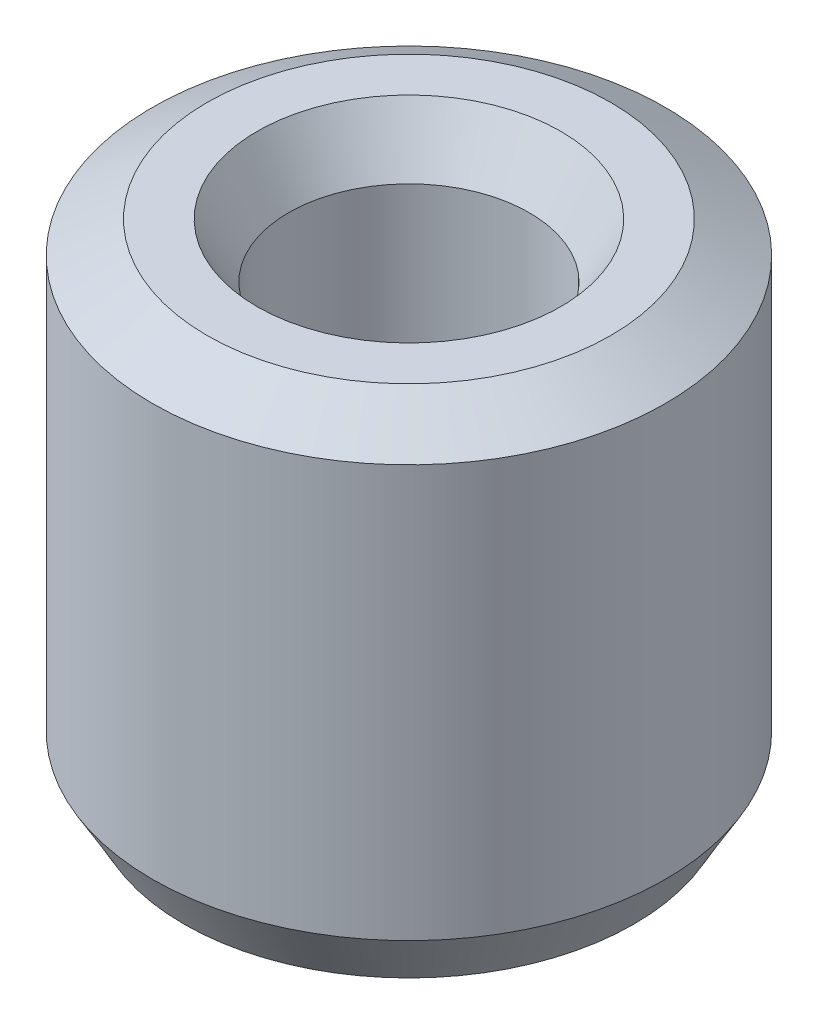
from build123d import *
from OCP.BRepFilletAPI import BRepFilletAPI_MakeChamfer

# Parameters (mm, degrees)
SKETCH1_R           = 30
BOSS_EXTRUDE1_DEPTH = 58.277309649
SKETCH2_R           = 14.073337656
CUT_EXTRUDE1_DEPTH  = 73.084983318
CHAMFER1_SIZE       = 3.689732428
CHAMFER1_SIZE2      = 6.390804031


with BuildPart() as part:
    # Sketch1 → Boss-Extrude1 (new body)
    with BuildSketch(Plane(origin=(0, 0, 0), x_dir=(1, 0, 0), z_dir=(0, 1, 0))):
        Circle(SKETCH1_R)
    extrude(amount=BOSS_EXTRUDE1_DEPTH)

    # Sketch2 → Cut-Extrude1 (cut, through all)
    with BuildSketch(Plane(origin=(0, 0, 0), x_dir=(1, 0, 0), z_dir=(0, 1, 0))):
        Circle(SKETCH2_R)
    extrude(amount=CUT_EXTRUDE1_DEPTH, mode=Mode.SUBTRACT)

    # Chamfer1: one chamfer whose edges measure the first distance from different faces: ONE call of the kernel's chamfer builder (chamfer() names one face for all edges)
    chamfer1_edges_1 = [part.edges().sort_by_distance(p)[0] for p in [
        (-14.073337656, 58.277309649, 0),
    ]]
    chamfer1_side_1 = [part.faces().sort_by_distance(p)[0] for p in [
        (-29.151471863, 58.277309649, 0),
    ]]
    chamfer1_edges_2 = [part.edges().sort_by_distance(p)[0] for p in [
        (-14.073337656, 0, 0),
    ]]
    chamfer1_side_2 = [part.faces().sort_by_distance(p)[0] for p in [
        (-14.073337656, 29.138654825, 0),
    ]]
    chamfer1_edges_3 = [part.edges().sort_by_distance(p)[0] for p in [
        (-30, 0, 0),
    ]]
    chamfer1_side_3 = [part.faces().sort_by_distance(p)[0] for p in [
        (-29.151471863, 0, 0),
    ]]
    chamfer1_edges_4 = [part.edges().sort_by_distance(p)[0] for p in [
        (-30, 58.277309649, 0),
    ]]
    chamfer1_side_4 = [part.faces().sort_by_distance(p)[0] for p in [
        (-30, 29.138654825, 0),
    ]]
    chamfer1 = BRepFilletAPI_MakeChamfer(part.part.solid().wrapped)
    for e in chamfer1_edges_1:
        chamfer1.Add(CHAMFER1_SIZE, CHAMFER1_SIZE2, e.wrapped, chamfer1_side_1[0].wrapped)  # the first distance lies on this face
    for e in chamfer1_edges_2:
        chamfer1.Add(CHAMFER1_SIZE, CHAMFER1_SIZE2, e.wrapped, chamfer1_side_2[0].wrapped)  # the first distance lies on this face
    for e in chamfer1_edges_3:
        chamfer1.Add(CHAMFER1_SIZE, CHAMFER1_SIZE2, e.wrapped, chamfer1_side_3[0].wrapped)  # the first distance lies on this face
    for e in chamfer1_edges_4:
        chamfer1.Add(CHAMFER1_SIZE, CHAMFER1_SIZE2, e.wrapped, chamfer1_side_4[0].wrapped)  # the first distance lies on this face
    add(Compound.cast(chamfer1.Shape()), mode=Mode.REPLACE)


solid = part.part
